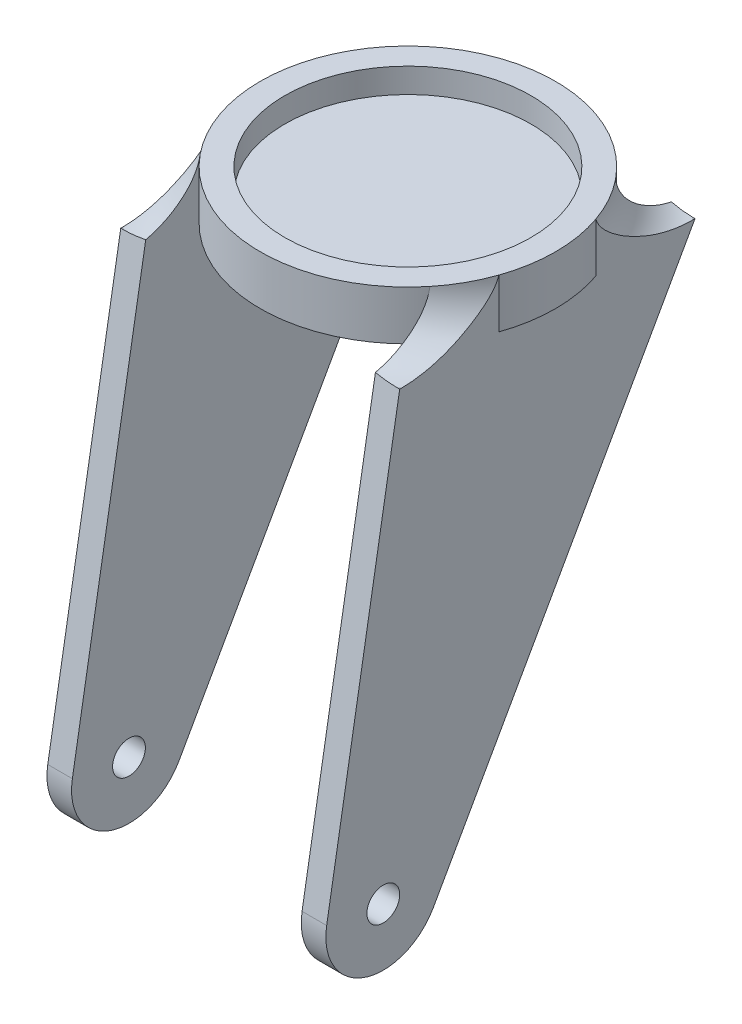
from build123d import *

# Parameters (mm, degrees)
ESQUISSE1_R        = 18
ESQUISSE1_R_2      = 15
BOSS_EXTRU_1_DEPTH = 3
BOSS_EXTRU_3_START = 3
ESQUISSE3_R        = 18
BOSS_EXTRU_3_DEPTH = 3
BOSS_EXTRU_2_START = 14
ESQUISSE2_R        = 2
BOSS_EXTRU_2_DEPTH = 3
FILLET1_R          = 6.6


with BuildPart() as part:
    # Esquisse1 → Boss.-Extru.1 (new body)
    with BuildSketch(Plane(origin=(0, 0, 0), x_dir=(1, 0, 0), z_dir=(0, 1, 0))):
        with Locations(Location((0, 0, 0), (0, 0, 270))):
            Circle(ESQUISSE1_R)
        with Locations(Location((0, 0, 0), (0, 0, 270))):
            Circle(ESQUISSE1_R_2, mode=Mode.SUBTRACT)
    extrude(amount=BOSS_EXTRU_1_DEPTH)

    # Esquisse3 → Boss.-Extru.3 (add)
    with BuildSketch(Plane.XZ.offset(BOSS_EXTRU_3_START)):
        with Locations(Location((0, 0, 0), (0, 0, 270))):
            Circle(ESQUISSE3_R)
    extrude(amount=-BOSS_EXTRU_3_DEPTH)

    # Esquisse2 → Boss.-Extru.2 (add)
    with BuildSketch(Plane(origin=(0, 0, 0), x_dir=(0, 0, -1), z_dir=(1, 0, 0)).offset(BOSS_EXTRU_2_START)):
        with BuildLine():
            Line((-18, -3), (-26.900313921, -55.172856085))
            ThreePointArc((-26.900313921, -55.172856085), (-22.337080841, -62.94833715), (-13.89709797, -59.778496291))
            Line((-13.89709797, -59.778496291), (18, -3))
            Line((18, -3), (-18, -3))
        make_face()
        with Locations((-20, -56.35)):
            Circle(ESQUISSE2_R, mode=Mode.SUBTRACT)
    boss_extru_2 = extrude(amount=BOSS_EXTRU_2_DEPTH)

    # Symétrie1: Boss.-Extru.2 across plane
    add(boss_extru_2.mirror(Plane(origin=(0, 0, 0), x_dir=(0, 0, 1), z_dir=(1, 0, 0))))

    # Fillet1
    # the kernel refuses this fillet: 6.6 mm, written as the material it adds along each edge
    with BuildSketch(Plane(origin=(0, -3, 0), x_dir=(-0.8375611584299304, 0, 0.5463435786110358), z_dir=(0.5463435786110358, 0, 0.8375611584299304))) as fillet1_piece_1_section:
        with BuildLine():
            CenterArc((24.57267069, -6.6), FILLET1_R, 90, 84.78409143)
            Line((24.57267069, 0), (18, 0))
            Line((18, 0), (18, -6))
        make_face()
    fillet1_piece_1 = revolve(axis=Axis((0, -3, 0), (0, -1, 0)), revolution_arc=124.363631706, mode=Mode.PRIVATE)
    fillet1_piece_1 = split(fillet1_piece_1, bisect_by=Plane(origin=(-14, -3, 0), z_dir=(-1, 0, 0)), keep=Keep.TOP, mode=Mode.PRIVATE)
    fillet1_piece_1 = split(fillet1_piece_1, bisect_by=Plane(origin=(-17, -3, 0), z_dir=(1, 0, 0)), keep=Keep.TOP, mode=Mode.PRIVATE)
    fillet1_piece_1 = split(fillet1_piece_1, bisect_by=Plane(origin=(0, -10.686285419, -13.681988516), z_dir=(0, 0.4897851844267101, 0.871843147083289)), keep=Keep.TOP, mode=Mode.PRIVATE)
    add(fillet1_piece_1)
    with BuildSketch(Plane(origin=(0, -3, 0), x_dir=(0.021764364768608612, 0, 0.999763128158975), z_dir=(0.999763128158975, 0, -0.021764364768608612))) as fillet1_piece_2_section:
        with BuildLine():
            CenterArc((24.57267069, -6.6), FILLET1_R, 90, 84.78409143)
            Line((24.57267069, 0), (18, 0))
            Line((18, 0), (18, -6))
        make_face()
    fillet1_piece_2 = revolve(axis=Axis((0, -3, 0), (0, -1, 0)), revolution_arc=124.363631706, mode=Mode.PRIVATE)
    fillet1_piece_2 = split(fillet1_piece_2, bisect_by=Plane(origin=(-14, -3, 0), z_dir=(-1, 0, 0)), keep=Keep.TOP, mode=Mode.PRIVATE)
    fillet1_piece_2 = split(fillet1_piece_2, bisect_by=Plane(origin=(0, -0.016164781, 17.490979177), z_dir=(0, -0.1681634163647939, -0.9857591315308831)), keep=Keep.TOP, mode=Mode.PRIVATE)
    fillet1_piece_2 = split(fillet1_piece_2, bisect_by=Plane(origin=(-17, -3, 0), z_dir=(1, 0, 0)), keep=Keep.TOP, mode=Mode.PRIVATE)
    add(fillet1_piece_2)
    with BuildSketch(Plane(origin=(0, -3, 0), x_dir=(-0.021764364768691844, 0, -0.9997631281589732), z_dir=(-0.9997631281589732, 0, 0.021764364768691844))) as fillet1_piece_3_section:
        with BuildLine():
            CenterArc((24.57267069, -6.6), FILLET1_R, 90, 84.78409143)
            Line((24.57267069, 0), (18, 0))
            Line((18, 0), (18, -6))
        make_face()
    fillet1_piece_3 = revolve(axis=Axis((0, -3, 0), (0, -1, 0)), revolution_arc=124.363631706, mode=Mode.PRIVATE)
    fillet1_piece_3 = split(fillet1_piece_3, bisect_by=Plane(origin=(14, -3, 0), z_dir=(1, 0, 0)), keep=Keep.TOP, mode=Mode.PRIVATE)
    fillet1_piece_3 = split(fillet1_piece_3, bisect_by=Plane(origin=(17, -3, 0), z_dir=(-1, 0, 0)), keep=Keep.TOP, mode=Mode.PRIVATE)
    fillet1_piece_3 = split(fillet1_piece_3, bisect_by=Plane(origin=(0, -10.686285419, -13.681988516), z_dir=(0, 0.4897851844267101, 0.871843147083289)), keep=Keep.TOP, mode=Mode.PRIVATE)
    add(fillet1_piece_3)
    with BuildSketch(Plane(origin=(0, -3, 0), x_dir=(0.8375611584299263, 0, -0.5463435786110422), z_dir=(-0.5463435786110422, 0, -0.8375611584299263))) as fillet1_piece_4_section:
        with BuildLine():
            CenterArc((24.57267069, -6.6), FILLET1_R, 90, 84.78409143)
            Line((24.57267069, 0), (18, 0))
            Line((18, 0), (18, -6))
        make_face()
    fillet1_piece_4 = revolve(axis=Axis((0, -3, 0), (0, -1, 0)), revolution_arc=124.363631706, mode=Mode.PRIVATE)
    fillet1_piece_4 = split(fillet1_piece_4, bisect_by=Plane(origin=(14, -3, 0), z_dir=(1, 0, 0)), keep=Keep.TOP, mode=Mode.PRIVATE)
    fillet1_piece_4 = split(fillet1_piece_4, bisect_by=Plane(origin=(17, -3, 0), z_dir=(-1, 0, 0)), keep=Keep.TOP, mode=Mode.PRIVATE)
    fillet1_piece_4 = split(fillet1_piece_4, bisect_by=Plane(origin=(0, -0.016164781, 17.490979177), z_dir=(0, -0.1681634163647939, -0.9857591315308831)), keep=Keep.TOP, mode=Mode.PRIVATE)
    add(fillet1_piece_4)


solid = part.part
